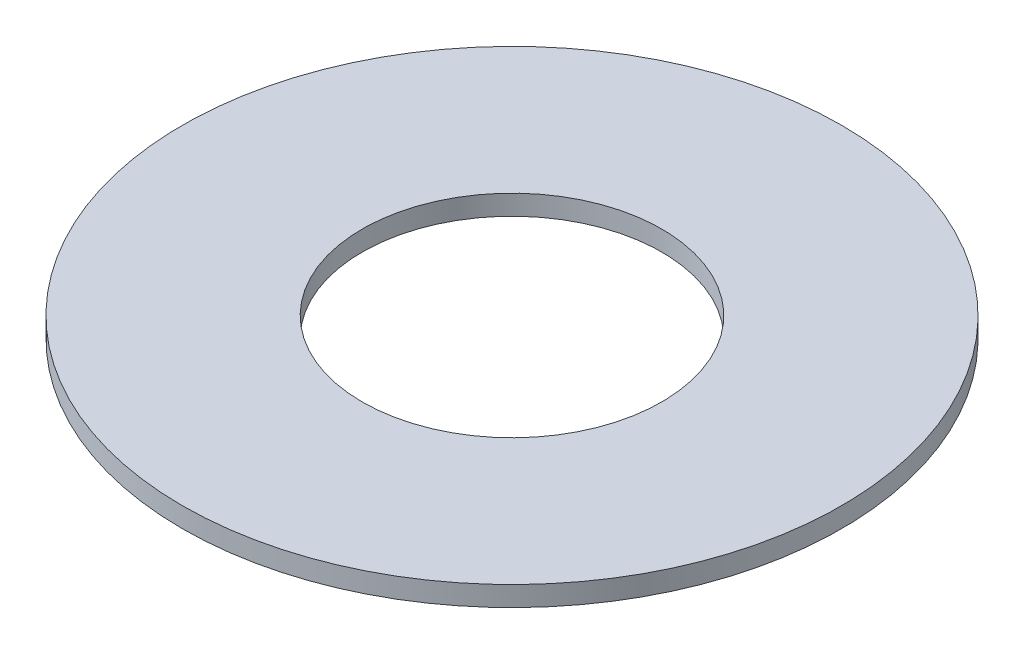
from build123d import *

# Parameters (mm, degrees)
SKETCH1_R           = 82.5
BOSS_EXTRUDE1_DEPTH = 5
SKETCH2_R           = 37.5
CUT_EXTRUDE1_DEPTH  = 117.779707141


with BuildPart() as part:
    # Sketch1 → Boss-Extrude1 (new body)
    with BuildSketch(Plane(origin=(0, 0, 0), x_dir=(1, 0, 0), z_dir=(0, 1, 0))):
        Circle(SKETCH1_R)
    extrude(amount=BOSS_EXTRUDE1_DEPTH)

    # Sketch2 → Cut-Extrude1 (cut, through all)
    with BuildSketch(Plane(origin=(0, 0, 0), x_dir=(1, 0, 0), z_dir=(0, 1, 0))):
        Circle(SKETCH2_R)
    extrude(amount=CUT_EXTRUDE1_DEPTH, mode=Mode.SUBTRACT)


solid = part.part
